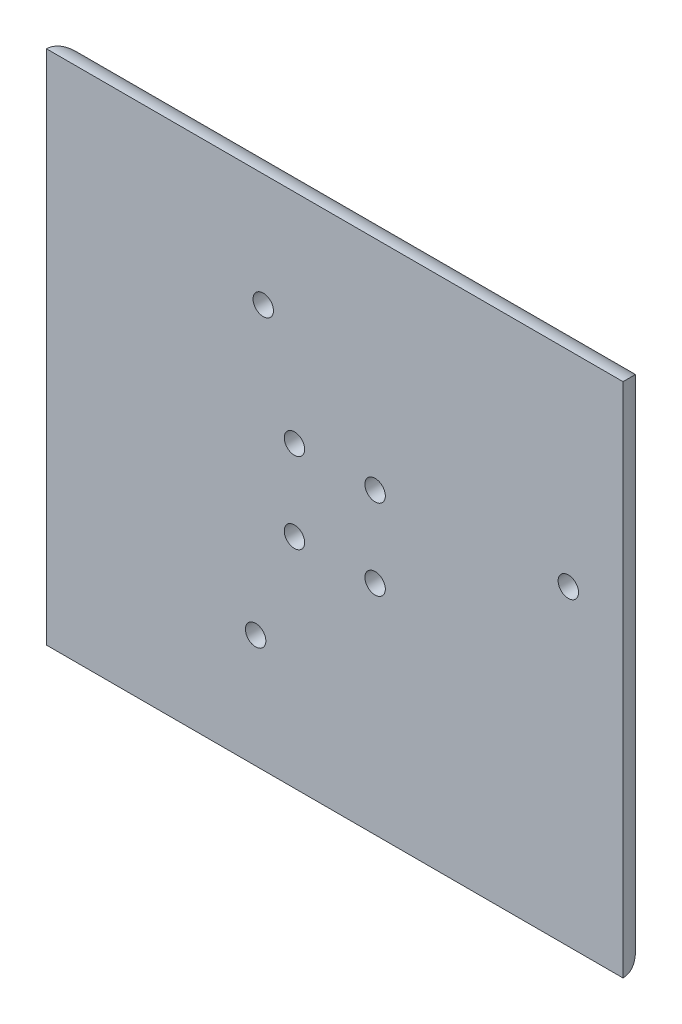
from build123d import *

# Parameters (mm, degrees)
ESQUISSE1_W        = 96
ESQUISSE1_H        = 86
BOSS_EXTRU_1_DEPTH = 5
CONG_2_R           = 5
TROUM3_D           = 3.4


with BuildPart() as part:
    # Esquisse1 → Boss.-Extru.1 (new body)
    with BuildSketch(Plane.XY):
        with Locations((2.2, -13.159463773)):
            Rectangle(ESQUISSE1_W, ESQUISSE1_H)
    extrude(amount=BOSS_EXTRU_1_DEPTH)

    # Congé2
    cong_2_edges = [part.edges().sort_by_distance(p)[0] for p in [
        (-45.8, -13.159463773, 0),
        (2.2, -56.159463773, 0),
        (50.2, -13.159463773, 0),
        (2.2, 29.840536227, 0),
    ]]
    fillet(cong_2_edges, radius=CONG_2_R - 0.0001)  # a hair under: the kernel refuses the full size

    # TrouM3 (through all)
    with Locations(Plane.XY.offset(5)):
        with Locations((-9.71, 10.960536227), (41.09, -4.279463773), (-10.98, -37.299463773), (-4.517514421, -19.876978194), (-4.517514421, -6.441949352), (8.917514421, -6.441949352), (8.917514421, -19.876978194)):
            Hole(TROUM3_D / 2)


solid = part.part
